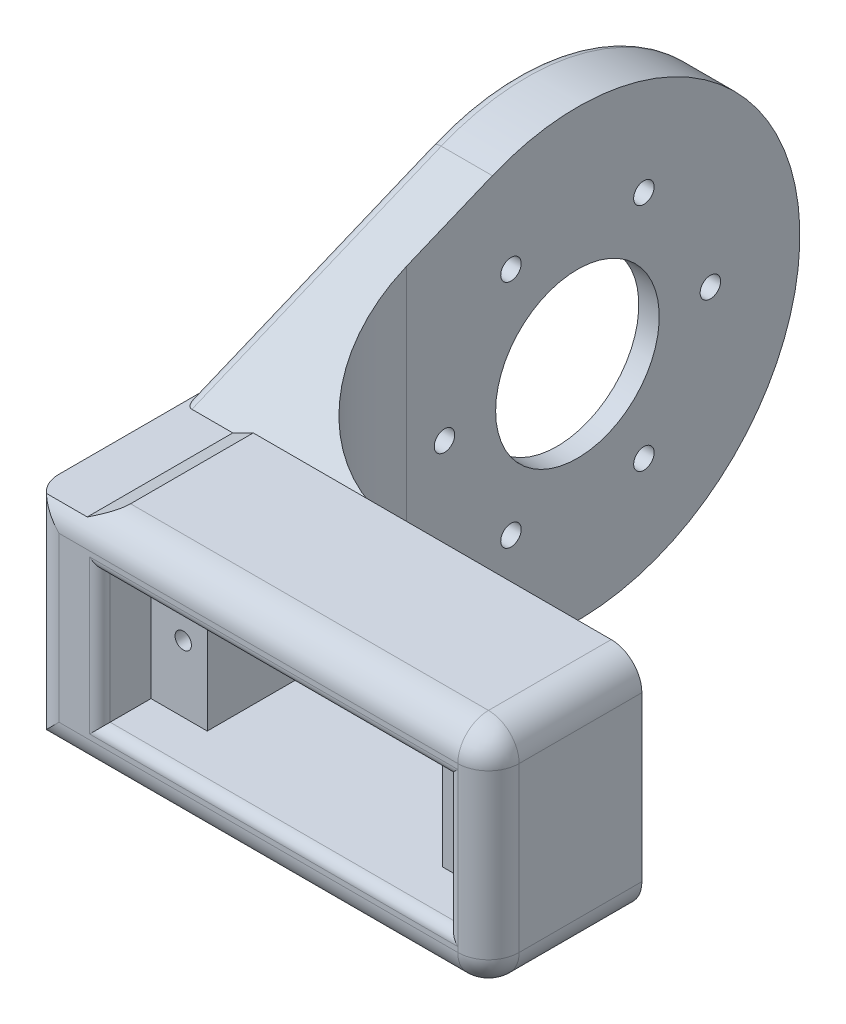
from build123d import *

# Parameters (mm, degrees)
SKETCH_1_W              = 23
SKETCH_1_H              = 13
EXTRUDE_1_DEPTH         = 10
EXTRUDE_START           = 10
SKETCH_1_5_W            = 4
SKETCH_1_5_H            = 22
SKETCH_1_5_W_2          = 5
SKETCH_1_5_H_2          = 20
EXTRUDE_2_DEPTH         = 5
SKETCH_9_R              = 21.75
SKETCH_9_R_2            = 18.75
SKETCH_9_R_3            = 8
EXTRUDE_4_DEPTH         = 6
SKETCH_9_5_R            = 18.75
CUT_EXTRUDE_4_DEPTH     = 4
FILLET_6_R              = 1
SKETCH_10_R             = 1
CUT_EXTRUDE_5_DEPTH     = 4
FILLET_3_R              = 1
HOLE_WIZARD_M1_41_D     = 1.6
HOLE_WIZARD_M1_41_DEPTH = 4.519311505
HOLE_WIZARD_M1_41_TIP   = 0.480688495
FILLET_7_R              = 3
FILLET_8_R              = 16


with BuildPart() as part:
    # Эскиз1 → Бобышка-Вытянуть1 (new body)
    with BuildSketch(Plane.XY):
        Polygon((-17, -11), (21, -11), (21, 11), (-17, 11), (-19, 10), (-24, 10), (-24, -10), (-19, -10), align=None)
        Rectangle(SKETCH_1_W, SKETCH_1_H, mode=Mode.SUBTRACT)
    extrude(amount=EXTRUDE_1_DEPTH)

    # Эскиз1<5> → Бобышка-Вытянуть2 (add)
    with BuildSketch(Plane.XY.offset(EXTRUDE_START)):
        Polygon((-11.5, 6.5), (11.5, 6.5), (17, 6.5), (17, 11), (-17, 11), (-17, 6.5), align=None)
        with Locations((19, 0)):
            Rectangle(SKETCH_1_5_W, SKETCH_1_5_H)
        Polygon((17, -6.5), (11.5, -6.5), (-11.5, -6.5), (-17, -6.5), (-17, -11), (17, -11), align=None)
        Polygon((-19, -10), (-19, 10), (-17, 11), (-17, -11), align=None)
        with Locations((-21.5, 0)):
            Rectangle(SKETCH_1_5_W_2, SKETCH_1_5_H_2)
    extrude(amount=EXTRUDE_2_DEPTH)

    # Эскиз9 → Бобышка-Вытянуть4 (add)
    # profile 1 of 3: a face of its own
    with BuildSketch(Plane.ZY.offset(24)):
        with Locations((-32.7, 0)):
            Circle(SKETCH_9_R)
        with Locations((-32.7, 0)):
            Circle(SKETCH_9_R_2, mode=Mode.SUBTRACT)
    # profile 2 of 3: a face of its own
    with BuildSketch(Plane.ZY.offset(24)):
        with BuildLine():
            ThreePointArc((-10.95, 0), (-14.616118395, -12.08452424), (-24.378572515, -20.095182124))
            Line((-24.378572515, -20.095182124), (0, -10))
            Line((0, -10), (0, 10))
            Line((0, 10), (-24.378572515, 20.095182124))
            ThreePointArc((-24.378572515, 20.095182124), (-14.616118395, 12.08452424), (-10.95, 0))
        make_face()
    # profile 3 of 3: a face of its own
    with BuildSketch(Plane.ZY.offset(24)):
        with Locations((-32.7, 0)):
            Circle(SKETCH_9_R_2)
        with Locations((-32.7, 0)):
            Circle(SKETCH_9_R_3, mode=Mode.SUBTRACT)
    extrude(amount=-EXTRUDE_4_DEPTH)

    # Эскиз9<5> → Вырез-Вытянуть4 (cut)
    with BuildSketch(Plane.ZY.offset(24)):
        with Locations((-32.7, 0)):
            Circle(SKETCH_9_5_R)
    extrude(amount=-CUT_EXTRUDE_4_DEPTH, mode=Mode.SUBTRACT)

    # Скругление6
    fillet_6_edges = [part.edges().sort_by_distance(p)[0] for p in [
        (-24, 0, -51.45),
        (-24, 0, -54.45),
        (-24, -15.047591062, -12.189286258),
        (-24, 15.047591062, -12.189286258),
    ]]
    fillet(fillet_6_edges, radius=FILLET_6_R)

    # Эскиз10 → Вырез-Вытянуть5 (cut)
    with BuildSketch(Plane.ZY.offset(20)):
        with Locations((-45.698540936, 0)):
            Circle(SKETCH_10_R)
        with Locations((-39.198031114, 11.257782204)):
            Circle(SKETCH_10_R)
        with Locations((-26.198250825, 11.257066663)):
            Circle(SKETCH_10_R)
        with Locations((-19.698980357, -0.001431082)):
            Circle(SKETCH_10_R)
        with Locations((-26.199490179, -11.259213286)):
            Circle(SKETCH_10_R)
        with Locations((-39.199270468, -11.258497745)):
            Circle(SKETCH_10_R)
    extrude(amount=-CUT_EXTRUDE_5_DEPTH, mode=Mode.SUBTRACT)

    # Скругление3
    fillet_3_edges = [part.edges().sort_by_distance(p)[0] for p in [
        (0, 6.5, 15),
        (17, 0, 15),
        (-17, 0, 15),
        (0, -6.5, 15),
    ]]
    fillet(fillet_3_edges, radius=FILLET_3_R)

    # Отверстие с зазором M1.41
    with Locations(Plane.XY.offset(10)):
        with Locations((13.85, 0), (-13.85, 0)):
            Hole(HOLE_WIZARD_M1_41_D / 2, depth=HOLE_WIZARD_M1_41_DEPTH)
            with Locations((0, 0, -(HOLE_WIZARD_M1_41_DEPTH + HOLE_WIZARD_M1_41_TIP / 2))):  # 118° drill point
                Cone(0, HOLE_WIZARD_M1_41_D / 2, HOLE_WIZARD_M1_41_TIP, mode=Mode.SUBTRACT)

    # Скругление7
    # the kernel refuses this fillet: 3 mm, written as the material it takes off along each edge
    with BuildSketch(Plane(origin=(18, -8, 12), x_dir=(0, -1, 0), z_dir=(0, 0, 1))) as fillet_7_piece_1_section:
        Polygon((0, 0), (FILLET_7_R, 0), (FILLET_7_R, FILLET_7_R), (0, FILLET_7_R), align=None)
    fillet_7_piece_1 = extrude(amount=FILLET_7_R, mode=Mode.PRIVATE)
    fillet_7_piece_1 = fillet_7_piece_1 - Plane(origin=(18, -8, 12), x_dir=(-0.7071067811865475, 0.7071067811865475, 0), z_dir=(0, 0, 1)) * Sphere(FILLET_7_R, mode=Mode.PRIVATE)
    add(fillet_7_piece_1, mode=Mode.SUBTRACT)
    with BuildSketch(Plane(origin=(18, 8, 12), x_dir=(1, 0, 0), z_dir=(0, 0, 1))) as fillet_7_piece_2_section:
        Polygon((0, 0), (FILLET_7_R, 0), (FILLET_7_R, FILLET_7_R), (0, FILLET_7_R), align=None)
    fillet_7_piece_2 = extrude(amount=FILLET_7_R, mode=Mode.PRIVATE)
    fillet_7_piece_2 = fillet_7_piece_2 - Plane(origin=(18, 8, 12), x_dir=(-0.7071067811865475, -0.7071067811865476, 0), z_dir=(0, 0, 1)) * Sphere(FILLET_7_R, mode=Mode.PRIVATE)
    add(fillet_7_piece_2, mode=Mode.SUBTRACT)
    with BuildSketch(Plane(origin=(21, -8, 15), x_dir=(-1, 0, 0), z_dir=(0, 1, 0))) as fillet_7_piece_3:
        with BuildLine():
            CenterArc((FILLET_7_R, -FILLET_7_R), FILLET_7_R, 90, 90)
            Line((0, -FILLET_7_R), (0, 0))
            Line((0, 0), (FILLET_7_R, 0))
        make_face()
    extrude(amount=16, mode=Mode.SUBTRACT)
    with BuildSketch(Plane(origin=(-24.5, -11, 15), x_dir=(0, 1, 0), z_dir=(1, 0, 0)), Plane(origin=(18, 11, 15), x_dir=(0, -1, 0), z_dir=(-1, 0, 0))) as fillet_7_piece_4:
        with BuildLine():
            CenterArc((FILLET_7_R, -FILLET_7_R), FILLET_7_R, 90, 90)
            Line((0, -FILLET_7_R), (0, 0))
            Line((0, 0), (FILLET_7_R, 0))
        make_face()
    extrude(amount=42.5, mode=Mode.SUBTRACT)
    with BuildSketch(Plane(origin=(21, 11, -7.5), x_dir=(0, -1, 0), z_dir=(0, 0, 1)), Plane(origin=(21, -11, -7.5), x_dir=(-1, 0, 0), z_dir=(0, 0, 1))) as fillet_7_piece_5:
        with BuildLine():
            CenterArc((FILLET_7_R, -FILLET_7_R), FILLET_7_R, 90, 90)
            Line((0, -FILLET_7_R), (0, 0))
            Line((0, 0), (FILLET_7_R, 0))
        make_face()
    extrude(amount=19.5, mode=Mode.SUBTRACT)
    with BuildSketch(Plane(origin=(-24, -17.5, 15), x_dir=(1, 0, 0), z_dir=(0, 1, 0))) as fillet_7_piece_6:
        with BuildLine():
            CenterArc((FILLET_7_R, FILLET_7_R), FILLET_7_R, 180, 90)
            Line((0, FILLET_7_R), (0, 0))
            Line((0, 0), (FILLET_7_R, 0))
        make_face()
    extrude(amount=35, mode=Mode.SUBTRACT)

    # Скругление8
    # the kernel refuses this fillet: 16 mm, written as the material it adds along each edge
    with BuildSketch(Plane(origin=(-18, -50, 0), x_dir=(1, 0, 0), z_dir=(0, 1, 0))) as fillet_8_piece_1_section:
        with BuildLine():
            CenterArc((FILLET_8_R, FILLET_8_R), FILLET_8_R, 180, 90)
            Line((0, FILLET_8_R), (0, 0))
            Line((0, 0), (FILLET_8_R, 0))
        make_face()
    fillet_8_piece_1 = extrude(amount=100, mode=Mode.PRIVATE)
    fillet_8_piece_1 = split(fillet_8_piece_1, bisect_by=Plane(origin=(-17.157282296, -13.337247559, -8.059025643), z_dir=(0, 0.9239164195137738, -0.38259436712117)), keep=Keep.TOP, mode=Mode.PRIVATE)
    fillet_8_piece_1 = split(fillet_8_piece_1, bisect_by=Plane(origin=(-17.157282296, 9.732934462, 0.644929087), z_dir=(0, -0.9239164195137736, -0.3825943671211702)), keep=Keep.TOP, mode=Mode.PRIVATE)
    fillet_8_piece_1 = split(fillet_8_piece_1, bisect_by=Plane(origin=(-11.5, -12.311624775, -8.483736679), z_dir=(-1, 0, 0)), keep=Keep.TOP, mode=Mode.PRIVATE)
    add(fillet_8_piece_1)
    with BuildSketch(Plane(origin=(-18, -50, 0), x_dir=(1, 0, 0), z_dir=(0, 1, 0))) as fillet_8_piece_2_section:
        with BuildLine():
            CenterArc((FILLET_8_R, FILLET_8_R), FILLET_8_R, 180, 90)
            Line((0, FILLET_8_R), (0, 0))
            Line((0, 0), (FILLET_8_R, 0))
        make_face()
    fillet_8_piece_2 = extrude(amount=100, mode=Mode.PRIVATE)
    fillet_8_piece_2 = split(fillet_8_piece_2, bisect_by=Plane(origin=(-11.244845554, -6.5, -2.767260165), z_dir=(0, -1, 0)), keep=Keep.TOP, mode=Mode.PRIVATE)
    fillet_8_piece_2 = split(fillet_8_piece_2, bisect_by=Plane(origin=(-11.244845554, -11.135244088, -2.741469147), z_dir=(0, 0.9239164195137738, -0.38259436712117)), keep=Keep.TOP, mode=Mode.PRIVATE)
    add(fillet_8_piece_2)
    with BuildSketch(Plane(origin=(-18, -50, 0), x_dir=(1, 0, 0), z_dir=(0, 1, 0))) as fillet_8_piece_3_section:
        with BuildLine():
            CenterArc((FILLET_8_R, FILLET_8_R), FILLET_8_R, 180, 90)
            Line((0, FILLET_8_R), (0, 0))
            Line((0, 0), (FILLET_8_R, 0))
        make_face()
    fillet_8_piece_3 = extrude(amount=100, mode=Mode.PRIVATE)
    fillet_8_piece_3 = split(fillet_8_piece_3, bisect_by=Plane(origin=(-9.25068262, 6.5, -0.972078171), z_dir=(0, 1, 0)), keep=Keep.TOP, mode=Mode.PRIVATE)
    fillet_8_piece_3 = split(fillet_8_piece_3, bisect_by=Plane(origin=(-9.25068262, 10.116600815, -0.281576041), z_dir=(0, -0.9239164195137736, -0.3825943671211702)), keep=Keep.TOP, mode=Mode.PRIVATE)
    add(fillet_8_piece_3)


solid = part.part
